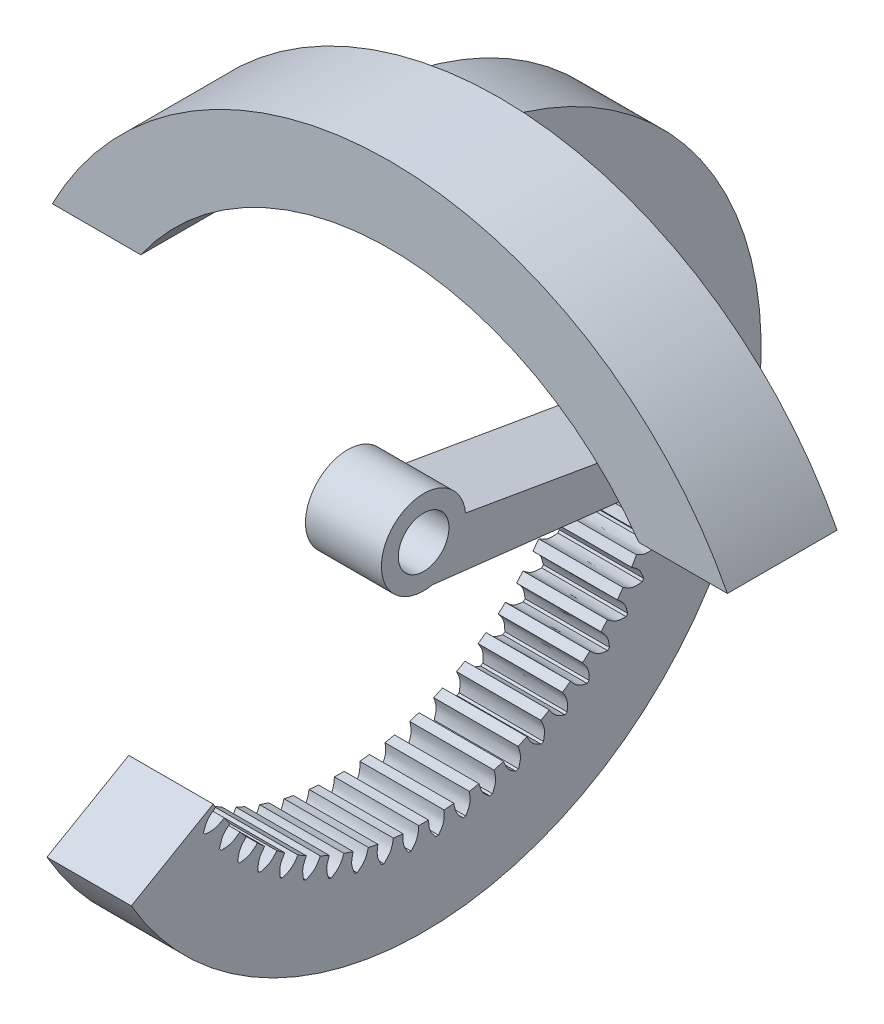
from build123d import *

# Parameters (mm, degrees)
KUGGLUCKA_DEPTH          = 15
CIRPATTERN_COUNT         = 60
SKETCH1_R                = 40
BOSS_EXTRUDE1_DEPTH      = 10
COMBINE3_START           = -12.5
COMBINE3_DEPTH           = 25
CUT_EXTRUDE1_DEPTH       = 10
BOSS_EXTRUDE2_DEPTH      = 4
BOSS_EXTRUDE2_DEPTH_BACK = 9
SKETCH4_R                = 5
BOSS_EXTRUDE3_DEPTH      = 9
BOSS_EXTRUDE4_DEPTH      = 9
SKETCH6_R                = 3
CUT_EXTRUDE2_DEPTH       = 9


# Read off the part's stored shape, not the designer's step: Combine3
with BuildPart() as part:
    # Ritning 1 → Kugghjulsämne (revolve)
    with BuildSketch(Plane.XY, mode=Mode.PRIVATE) as kugghjuls_mne_sk:
        Polygon((-12.5, -9.5), (12.5, -9.5), (12.5, 4.5), (2.5, 4.5), (2.5, 15.5), (-12.5, 15.5), align=None)
    revolve(kugghjuls_mne_sk.sketch.rotate(Axis((-12.5, -15.5, 0), (1, 0, 0)), 90), axis=Axis((-12.5, -15.5, 0), (1, 0, 0)))

    # Ritning 2 → Kugglucka (cut)
    with BuildSketch(Plane.ZY.offset(12.5)):
        with BuildLine():
            Line((1.468439282, 15.465201212), (0, 16.933640493))
            Line((0, 16.933640493), (-1.468439282, 15.465201212))
            add(Edge.make_bspline(
                [(-1.468439282, 15.465201212), (-1.201451518, 15.156321595), (-0.662309062, 14.532584713), (-0.604027899, 13.709668563), (-0.574608045, 13.294267235)],
                knots=[0, 0, 0, 0, 0.495208197, 1, 1, 1, 1], degree=3))
            ThreePointArc((-0.574608045, 13.294267235), (0, 13.3), (0.574608045, 13.294267235))
            add(Edge.make_bspline(
                [(1.468439282, 15.465201212), (1.201451518, 15.156321595), (0.662309062, 14.532584713), (0.604027899, 13.709668563), (0.574608045, 13.294267235)],
                knots=[0, 0, 0, 0, 0.495208197, 1, 1, 1, 1], degree=3))
        make_face()
    kugglucka = extrude(amount=-KUGGLUCKA_DEPTH, mode=Mode.SUBTRACT)

    # CirPattern: Kugglucka ×60 about axis
    cirpattern_axis = Axis((-12.5, -15.5, 0), (-1, 0, 0))
    for i in range(1, CIRPATTERN_COUNT):
        add(kugglucka.rotate(cirpattern_axis, i * 360 / CIRPATTERN_COUNT), mode=Mode.SUBTRACT)


with BuildPart() as body_2:
    # Sketch1 → Boss-Extrude1 (new body)
    with BuildSketch(Plane.ZY.offset(12.5)):
        with Locations((0, -15.5)):
            Circle(SKETCH1_R)
    extrude(amount=-BOSS_EXTRUDE1_DEPTH)


with BuildPart() as combine3_tool:
    # Combine3 outline → Combine3 (new body)
    with BuildSketch(Plane.YZ.offset(COMBINE3_START)):
        with BuildLine():
            ThreePointArc((13.294267235, -0.574608045), (13.3, 0), (13.294267235, 0.574608045))
            add(Edge.make_bspline(
                [(13.294267235, 0.574608045), (13.709668563, 0.604027899), (14.532584713, 0.662309062), (15.156321595, 1.201451518), (15.465201212, 1.468439282)],
                knots=[0, 0, 0, 0, 0.504791803, 1, 1, 1, 1], degree=3))
            ThreePointArc((15.465201212, 1.468439282), (15.457515577, 1.622414644), (15.449064301, 1.77634988))
            add(Edge.make_bspline(
                [(15.449064301, 1.77634988), (15.113968939, 2.009588344), (14.437293221, 2.480579064), (13.61279305, 2.452522797), (13.196592122, 2.438360223)],
                knots=[0, 0, 0, 0, 0.495208197, 1, 1, 1, 1], degree=3))
            ThreePointArc((13.196592122, 2.438360223), (13.142230587, 3.010419742), (13.07646633, 3.581280787))
            add(Edge.make_bspline(
                [(13.07646633, 3.581280787), (13.486516834, 3.653960738), (14.298832924, 3.797940792), (14.862797177, 4.399328027), (15.142076898, 4.697139915)],
                knots=[0, 0, 0, 0, 0.504791803, 1, 1, 1, 1], degree=3))
            ThreePointArc((15.142076898, 4.697139915), (15.118338558, 4.849468416), (15.093842965, 5.00167698))
            add(Edge.make_bspline(
                [(15.093842965, 5.00167698), (14.736203232, 5.198610737), (14.014002478, 5.596289447), (13.196951685, 5.482203139), (12.784511141, 5.424613306)],
                knots=[0, 0, 0, 0, 0.495208197, 1, 1, 1, 1], degree=3))
            ThreePointArc((12.784511141, 5.424613306), (12.670650901, 5.987856695), (12.54557568, 6.548716267))
            add(Edge.make_bspline(
                [(12.54557568, 6.548716267), (12.945782761, 6.663860019), (13.738598884, 6.891961488), (14.236611599, 7.549004577), (14.483231577, 7.874377701)],
                knots=[0, 0, 0, 0, 0.504791803, 1, 1, 1, 1], degree=3))
            ThreePointArc((14.483231577, 7.874377701), (14.443700615, 8.023390398), (14.403429084, 8.172204661))
            add(Edge.make_bspline(
                [(14.403429084, 8.172204661), (14.027163356, 8.330676062), (13.267350149, 8.650685712), (12.466700511, 8.451819317), (12.062539137, 8.35143319)],
                knots=[0, 0, 0, 0, 0.495208197, 1, 1, 1, 1], degree=3))
            ThreePointArc((12.062539137, 8.35143319), (11.890427669, 8.899689438), (11.707411835, 9.444402642))
            add(Edge.make_bspline(
                [(11.707411835, 9.444402642), (12.09339074, 9.600748655), (12.858020637, 9.910472411), (13.284625482, 10.615972654), (13.495883697, 10.965342156)],
                knots=[0, 0, 0, 0, 0.504791803, 1, 1, 1, 1], degree=3))
            ThreePointArc((13.495883697, 10.965342156), (13.440993221, 11.109406436), (13.385386976, 11.253195957))
            add(Edge.make_bspline(
                [(13.385386976, 11.253195957), (12.994617699, 11.371468757), (12.205516711, 11.610303254), (11.430040315, 11.328835593), (11.038586186, 11.186753025)],
                knots=[0, 0, 0, 0, 0.495208197, 1, 1, 1, 1], degree=3))
            ThreePointArc((11.038586186, 11.186753025), (10.81010918, 11.714015321), (10.571157891, 12.236614165))
            add(Edge.make_bspline(
                [(10.571157891, 12.236614165), (10.938679755, 12.43244948), (11.666745982, 12.820402125), (12.017268984, 13.566629912), (12.190850848, 13.936168029)],
                knots=[0, 0, 0, 0, 0.504791803, 1, 1, 1, 1], degree=3))
            ThreePointArc((12.190850848, 13.936168029), (12.12120225, 14.073705492), (12.050870523, 14.210894884))
            add(Edge.make_bspline(
                [(12.050870523, 14.210894884), (11.649879047, 14.287673261), (10.840135834, 14.442715884), (10.098328961, 14.081730776), (9.723870931, 13.899508453)],
                knots=[0, 0, 0, 0, 0.495208197, 1, 1, 1, 1], degree=3))
            ThreePointArc((9.723870931, 13.899508453), (9.441531629, 14.4), (9.149262886, 14.894758782))
            add(Edge.make_bspline(
                [(9.149262886, 14.894758782), (9.494301062, 15.127937786), (10.177826772, 15.58986883), (10.448427529, 16.368648334), (10.582431242, 16.754306328)],
                knots=[0, 0, 0, 0, 0.504791803, 1, 1, 1, 1], degree=3))
            ThreePointArc((10.582431242, 16.754306328), (10.498787606, 16.883810085), (10.414500968, 17.012896272))
            add(Edge.make_bspline(
                [(10.414500968, 17.012896272), (10.00768064, 17.047339027), (9.186166918, 17.116891096), (8.486156958, 16.68034357), (8.132797668, 16.459977958)],
                knots=[0, 0, 0, 0, 0.495208197, 1, 1, 1, 1], degree=3))
            ThreePointArc((8.132797668, 16.459977958), (7.799689438, 16.928215266), (7.457305399, 17.389713305))
            add(Edge.make_bspline(
                [(7.457305399, 17.389713305), (7.776079576, 17.657681241), (8.407575919, 18.18852967), (8.595289672, 18.99132842), (8.688247061, 19.388880941)],
                knots=[0, 0, 0, 0, 0.504791803, 1, 1, 1, 1], degree=3))
            ThreePointArc((8.688247061, 19.388880941), (8.591524805, 19.508932123), (8.494206717, 19.628500809))
            add(Edge.make_bspline(
                [(8.494206717, 19.628500809), (8.086014745, 19.620230579), (7.26173119, 19.603530067), (6.611187601, 19.096203029), (6.282798529, 18.840108499)],
                knots=[0, 0, 0, 0, 0.495208197, 1, 1, 1, 1], degree=3))
            ThreePointArc((6.282798529, 18.840108499), (5.902570974, 19.270961463), (5.513822869, 19.69414249))
            add(Edge.make_bspline(
                [(5.513822869, 19.69414249), (5.802840492, 19.993963444), (6.375388661, 20.587913172), (6.478158779, 21.405935537), (6.529051383, 21.811026917)],
                knots=[0, 0, 0, 0, 0.504791803, 1, 1, 1, 1], degree=3))
            ThreePointArc((6.529051383, 21.811026917), (6.420310217, 21.920310217), (6.311026917, 22.029051383))
            add(Edge.make_bspline(
                [(6.311026917, 22.029051383), (5.905935537, 21.978158779), (5.087913172, 21.875388661), (4.493963444, 21.302840492), (4.19414249, 21.013822869)],
                knots=[0, 0, 0, 0, 0.495208197, 1, 1, 1, 1], degree=3))
            ThreePointArc((4.19414249, 21.013822869), (3.770961463, 21.402570974), (3.340108499, 21.782798529))
            add(Edge.make_bspline(
                [(3.340108499, 21.782798529), (3.596203029, 22.111187601), (4.103530067, 22.76173119), (4.120230579, 23.586014745), (4.128500809, 23.994206717)],
                knots=[0, 0, 0, 0, 0.504791803, 1, 1, 1, 1], degree=3))
            ThreePointArc((4.128500809, 23.994206717), (4.008932123, 24.091524805), (3.888880941, 24.188247061))
            add(Edge.make_bspline(
                [(3.888880941, 24.188247061), (3.49132842, 24.095289672), (2.68852967, 23.907575919), (2.157681241, 23.276079576), (1.889713305, 22.957305399)],
                knots=[0, 0, 0, 0, 0.495208197, 1, 1, 1, 1], degree=3))
            ThreePointArc((1.889713305, 22.957305399), (1.428215266, 23.299689438), (0.959977958, 23.632797668))
            add(Edge.make_bspline(
                [(0.959977958, 23.632797668), (1.18034357, 23.986156958), (1.616891096, 24.686166918), (1.547339027, 25.50768064), (1.512896272, 25.914500968)],
                knots=[0, 0, 0, 0, 0.504791803, 1, 1, 1, 1], degree=3))
            ThreePointArc((1.512896272, 25.914500968), (1.383810085, 25.998787606), (1.254306328, 26.082431242))
            add(Edge.make_bspline(
                [(1.254306328, 26.082431242), (0.868648334, 25.948427529), (0.08986883, 25.677826772), (-0.372062214, 24.994301062), (-0.605241218, 24.649262886)],
                knots=[0, 0, 0, 0, 0.495208197, 1, 1, 1, 1], degree=3))
            ThreePointArc((-0.605241218, 24.649262886), (-1.1, 24.941531629), (-1.600491547, 25.223870931))
            add(Edge.make_bspline(
                [(-1.600491547, 25.223870931), (-1.418269224, 25.598328961), (-1.057284116, 26.340135834), (-1.212326739, 27.149879047), (-1.289105116, 27.550870523)],
                knots=[0, 0, 0, 0, 0.504791803, 1, 1, 1, 1], degree=3))
            ThreePointArc((-1.289105116, 27.550870523), (-1.426294508, 27.62120225), (-1.563831971, 27.690850848))
            add(Edge.make_bspline(
                [(-1.563831971, 27.690850848), (-1.933370088, 27.517268984), (-2.679597875, 27.166745982), (-3.06755052, 26.438679755), (-3.263385835, 26.071157891)],
                knots=[0, 0, 0, 0, 0.495208197, 1, 1, 1, 1], degree=3))
            ThreePointArc((-3.263385835, 26.071157891), (-3.785984679, 26.31010918), (-4.313246975, 26.538586186))
            add(Edge.make_bspline(
                [(-4.313246975, 26.538586186), (-4.171164407, 26.930040315), (-3.889696746, 27.705516711), (-4.128531243, 28.494617699), (-4.246804043, 28.885386976)],
                knots=[0, 0, 0, 0, 0.504791803, 1, 1, 1, 1], degree=3))
            ThreePointArc((-4.246804043, 28.885386976), (-4.390593564, 28.940993221), (-4.534657844, 28.995883697))
            add(Edge.make_bspline(
                [(-4.534657844, 28.995883697), (-4.884027346, 28.784625482), (-5.589527589, 28.358020637), (-5.899251345, 27.59339074), (-6.055597358, 27.207411835)],
                knots=[0, 0, 0, 0, 0.495208197, 1, 1, 1, 1], degree=3))
            ThreePointArc((-6.055597358, 27.207411835), (-6.600310562, 27.390427669), (-7.14856681, 27.562539137))
            add(Edge.make_bspline(
                [(-7.14856681, 27.562539137), (-7.048180683, 27.966700511), (-6.849314288, 28.767350149), (-7.169323938, 29.527163356), (-7.327795339, 29.903429084)],
                knots=[0, 0, 0, 0, 0.504791803, 1, 1, 1, 1], degree=3))
            ThreePointArc((-7.327795339, 29.903429084), (-7.476609602, 29.943700615), (-7.625622299, 29.983231577))
            add(Edge.make_bspline(
                [(-7.625622299, 29.983231577), (-7.950995423, 29.736611599), (-8.608038512, 29.238598884), (-8.836139981, 28.445782761), (-8.951283733, 28.04557568)],
                knots=[0, 0, 0, 0, 0.495208197, 1, 1, 1, 1], degree=3))
            ThreePointArc((-8.951283733, 28.04557568), (-9.512143305, 28.170650901), (-10.075386694, 28.284511141))
            add(Edge.make_bspline(
                [(-10.075386694, 28.284511141), (-10.017796861, 28.696951685), (-9.903710553, 29.514002478), (-10.301389263, 30.236203232), (-10.49832302, 30.593842965)],
                knots=[0, 0, 0, 0, 0.504791803, 1, 1, 1, 1], degree=3))
            ThreePointArc((-10.49832302, 30.593842965), (-10.650531584, 30.618338558), (-10.802860085, 30.642076898))
            add(Edge.make_bspline(
                [(-10.802860085, 30.642076898), (-11.100671973, 30.362797177), (-11.702059208, 29.798832924), (-11.846039262, 28.986516834), (-11.918719213, 28.57646633)],
                knots=[0, 0, 0, 0, 0.495208197, 1, 1, 1, 1], degree=3))
            ThreePointArc((-11.918719213, 28.57646633), (-12.489580258, 28.642230587), (-13.061639777, 28.696592122))
            add(Edge.make_bspline(
                [(-13.061639777, 28.696592122), (-13.047477203, 29.11279305), (-13.019420936, 29.937293221), (-13.490411656, 30.613968939), (-13.72365012, 30.949064301)],
                knots=[0, 0, 0, 0, 0.504791803, 1, 1, 1, 1], degree=3))
            ThreePointArc((-13.72365012, 30.949064301), (-13.877585356, 30.957515577), (-14.031560718, 30.965201212))
            add(Edge.make_bspline(
                [(-14.031560718, 30.965201212), (-14.298548482, 30.656321595), (-14.837690938, 30.032584713), (-14.895972101, 29.209668563), (-14.925391955, 28.794267235)],
                knots=[0, 0, 0, 0, 0.495208197, 1, 1, 1, 1], degree=3))
            ThreePointArc((-14.925391955, 28.794267235), (-15.5, 28.8), (-16.074608045, 28.794267235))
            add(Edge.make_bspline(
                [(-16.074608045, 28.794267235), (-16.104027899, 29.209668563), (-16.162309062, 30.032584713), (-16.701451518, 30.656321595), (-16.968439282, 30.965201212)],
                knots=[0, 0, 0, 0, 0.504791803, 1, 1, 1, 1], degree=3))
            ThreePointArc((-16.968439282, 30.965201212), (-17.122414644, 30.957515577), (-17.27634988, 30.949064301))
            add(Edge.make_bspline(
                [(-17.27634988, 30.949064301), (-17.509588344, 30.613968939), (-17.980579064, 29.937293221), (-17.952522797, 29.11279305), (-17.938360223, 28.696592122)],
                knots=[0, 0, 0, 0, 0.495208197, 1, 1, 1, 1], degree=3))
            ThreePointArc((-17.938360223, 28.696592122), (-18.510419742, 28.642230587), (-19.081280787, 28.57646633))
            add(Edge.make_bspline(
                [(-19.081280787, 28.57646633), (-19.153960738, 28.986516834), (-19.297940792, 29.798832924), (-19.899328027, 30.362797177), (-20.197139915, 30.642076898)],
                knots=[0, 0, 0, 0, 0.504791803, 1, 1, 1, 1], degree=3))
            ThreePointArc((-20.197139915, 30.642076898), (-20.349468416, 30.618338558), (-20.50167698, 30.593842965))
            add(Edge.make_bspline(
                [(-20.50167698, 30.593842965), (-20.698610737, 30.236203232), (-21.096289447, 29.514002478), (-20.982203139, 28.696951685), (-20.924613306, 28.284511141)],
                knots=[0, 0, 0, 0, 0.495208197, 1, 1, 1, 1], degree=3))
            ThreePointArc((-20.924613306, 28.284511141), (-21.487856695, 28.170650901), (-22.048716267, 28.04557568))
            add(Edge.make_bspline(
                [(-22.048716267, 28.04557568), (-22.163860019, 28.445782761), (-22.391961488, 29.238598884), (-23.049004577, 29.736611599), (-23.374377701, 29.983231577)],
                knots=[0, 0, 0, 0, 0.504791803, 1, 1, 1, 1], degree=3))
            ThreePointArc((-23.374377701, 29.983231577), (-23.523390398, 29.943700615), (-23.672204661, 29.903429084))
            add(Edge.make_bspline(
                [(-23.672204661, 29.903429084), (-23.830676062, 29.527163356), (-24.150685712, 28.767350149), (-23.951819317, 27.966700511), (-23.85143319, 27.562539137)],
                knots=[0, 0, 0, 0, 0.495208197, 1, 1, 1, 1], degree=3))
            ThreePointArc((-23.85143319, 27.562539137), (-24.399689438, 27.390427669), (-24.944402642, 27.207411835))
            add(Edge.make_bspline(
                [(-24.944402642, 27.207411835), (-25.100748655, 27.59339074), (-25.410472411, 28.358020637), (-26.115972654, 28.784625482), (-26.465342156, 28.995883697)],
                knots=[0, 0, 0, 0, 0.504791803, 1, 1, 1, 1], degree=3))
            ThreePointArc((-26.465342156, 28.995883697), (-26.609406436, 28.940993221), (-26.753195957, 28.885386976))
            add(Edge.make_bspline(
                [(-26.753195957, 28.885386976), (-26.871468757, 28.494617699), (-27.110303254, 27.705516711), (-26.828835593, 26.930040315), (-26.686753025, 26.538586186)],
                knots=[0, 0, 0, 0, 0.495208197, 1, 1, 1, 1], degree=3))
            ThreePointArc((-26.686753025, 26.538586186), (-27.214015321, 26.31010918), (-27.736614165, 26.071157891))
            add(Edge.make_bspline(
                [(-27.736614165, 26.071157891), (-27.93244948, 26.438679755), (-28.320402125, 27.166745982), (-29.066629912, 27.517268984), (-29.436168029, 27.690850848)],
                knots=[0, 0, 0, 0, 0.504791803, 1, 1, 1, 1], degree=3))
            ThreePointArc((-29.436168029, 27.690850848), (-29.573705492, 27.62120225), (-29.710894884, 27.550870523))
            add(Edge.make_bspline(
                [(-29.710894884, 27.550870523), (-29.787673261, 27.149879047), (-29.942715884, 26.340135834), (-29.581730776, 25.598328961), (-29.399508453, 25.223870931)],
                knots=[0, 0, 0, 0, 0.495208197, 1, 1, 1, 1], degree=3))
            ThreePointArc((-29.399508453, 25.223870931), (-29.9, 24.941531629), (-30.394758782, 24.649262886))
            add(Edge.make_bspline(
                [(-30.394758782, 24.649262886), (-30.627937786, 24.994301062), (-31.08986883, 25.677826772), (-31.868648334, 25.948427529), (-32.254306328, 26.082431242)],
                knots=[0, 0, 0, 0, 0.504791803, 1, 1, 1, 1], degree=3))
            ThreePointArc((-32.254306328, 26.082431242), (-32.383810085, 25.998787606), (-32.512896272, 25.914500968))
            add(Edge.make_bspline(
                [(-32.512896272, 25.914500968), (-32.547339027, 25.50768064), (-32.616891096, 24.686166918), (-32.18034357, 23.986156958), (-31.959977958, 23.632797668)],
                knots=[0, 0, 0, 0, 0.495208197, 1, 1, 1, 1], degree=3))
            ThreePointArc((-31.959977958, 23.632797668), (-32.428215266, 23.299689438), (-32.889713305, 22.957305399))
            add(Edge.make_bspline(
                [(-32.889713305, 22.957305399), (-33.157681241, 23.276079576), (-33.68852967, 23.907575919), (-34.49132842, 24.095289672), (-34.888880941, 24.188247061)],
                knots=[0, 0, 0, 0, 0.504791803, 1, 1, 1, 1], degree=3))
            ThreePointArc((-34.888880941, 24.188247061), (-35.008932123, 24.091524805), (-35.128500809, 23.994206717))
            add(Edge.make_bspline(
                [(-35.128500809, 23.994206717), (-35.120230579, 23.586014745), (-35.103530067, 22.76173119), (-34.596203029, 22.111187601), (-34.340108499, 21.782798529)],
                knots=[0, 0, 0, 0, 0.495208197, 1, 1, 1, 1], degree=3))
            ThreePointArc((-34.340108499, 21.782798529), (-34.770961463, 21.402570974), (-35.19414249, 21.013822869))
            add(Edge.make_bspline(
                [(-35.19414249, 21.013822869), (-35.493963444, 21.302840492), (-36.087913172, 21.875388661), (-36.905935537, 21.978158779), (-37.311026917, 22.029051383)],
                knots=[0, 0, 0, 0, 0.504791803, 1, 1, 1, 1], degree=3))
            ThreePointArc((-37.311026917, 22.029051383), (-37.420310217, 21.920310217), (-37.529051383, 21.811026917))
            add(Edge.make_bspline(
                [(-37.529051383, 21.811026917), (-37.478158779, 21.405935537), (-37.375388661, 20.587913172), (-36.802840492, 19.993963444), (-36.513822869, 19.69414249)],
                knots=[0, 0, 0, 0, 0.495208197, 1, 1, 1, 1], degree=3))
            ThreePointArc((-36.513822869, 19.69414249), (-36.902570974, 19.270961463), (-37.282798529, 18.840108499))
            add(Edge.make_bspline(
                [(-37.282798529, 18.840108499), (-37.611187601, 19.096203029), (-38.26173119, 19.603530067), (-39.086014745, 19.620230579), (-39.494206717, 19.628500809)],
                knots=[0, 0, 0, 0, 0.504791803, 1, 1, 1, 1], degree=3))
            ThreePointArc((-39.494206717, 19.628500809), (-39.591524805, 19.508932123), (-39.688247061, 19.388880941))
            add(Edge.make_bspline(
                [(-39.688247061, 19.388880941), (-39.595289672, 18.99132842), (-39.407575919, 18.18852967), (-38.776079576, 17.657681241), (-38.457305399, 17.389713305)],
                knots=[0, 0, 0, 0, 0.495208197, 1, 1, 1, 1], degree=3))
            ThreePointArc((-38.457305399, 17.389713305), (-38.799689438, 16.928215266), (-39.132797668, 16.459977958))
            add(Edge.make_bspline(
                [(-39.132797668, 16.459977958), (-39.486156958, 16.68034357), (-40.186166918, 17.116891096), (-41.00768064, 17.047339027), (-41.414500968, 17.012896272)],
                knots=[0, 0, 0, 0, 0.504791803, 1, 1, 1, 1], degree=3))
            ThreePointArc((-41.414500968, 17.012896272), (-41.498787606, 16.883810085), (-41.582431242, 16.754306328))
            add(Edge.make_bspline(
                [(-41.582431242, 16.754306328), (-41.448427529, 16.368648334), (-41.177826772, 15.58986883), (-40.494301062, 15.127937786), (-40.149262886, 14.894758782)],
                knots=[0, 0, 0, 0, 0.495208197, 1, 1, 1, 1], degree=3))
            ThreePointArc((-40.149262886, 14.894758782), (-40.441531629, 14.4), (-40.723870931, 13.899508453))
            add(Edge.make_bspline(
                [(-40.723870931, 13.899508453), (-41.098328961, 14.081730776), (-41.840135834, 14.442715884), (-42.649879047, 14.287673261), (-43.050870523, 14.210894884)],
                knots=[0, 0, 0, 0, 0.504791803, 1, 1, 1, 1], degree=3))
            ThreePointArc((-43.050870523, 14.210894884), (-43.12120225, 14.073705492), (-43.190850848, 13.936168029))
            add(Edge.make_bspline(
                [(-43.190850848, 13.936168029), (-43.017268984, 13.566629912), (-42.666745982, 12.820402125), (-41.938679755, 12.43244948), (-41.571157891, 12.236614165)],
                knots=[0, 0, 0, 0, 0.495208197, 1, 1, 1, 1], degree=3))
            ThreePointArc((-41.571157891, 12.236614165), (-41.81010918, 11.714015321), (-42.038586186, 11.186753025))
            add(Edge.make_bspline(
                [(-42.038586186, 11.186753025), (-42.430040315, 11.328835593), (-43.205516711, 11.610303254), (-43.994617699, 11.371468757), (-44.385386976, 11.253195957)],
                knots=[0, 0, 0, 0, 0.504791803, 1, 1, 1, 1], degree=3))
            ThreePointArc((-44.385386976, 11.253195957), (-44.440993221, 11.109406436), (-44.495883697, 10.965342156))
            add(Edge.make_bspline(
                [(-44.495883697, 10.965342156), (-44.284625482, 10.615972654), (-43.858020637, 9.910472411), (-43.09339074, 9.600748655), (-42.707411835, 9.444402642)],
                knots=[0, 0, 0, 0, 0.495208197, 1, 1, 1, 1], degree=3))
            ThreePointArc((-42.707411835, 9.444402642), (-42.890427669, 8.899689438), (-43.062539137, 8.35143319))
            add(Edge.make_bspline(
                [(-43.062539137, 8.35143319), (-43.466700511, 8.451819317), (-44.267350149, 8.650685712), (-45.027163356, 8.330676062), (-45.403429084, 8.172204661)],
                knots=[0, 0, 0, 0, 0.504791803, 1, 1, 1, 1], degree=3))
            ThreePointArc((-45.403429084, 8.172204661), (-45.443700615, 8.023390398), (-45.483231577, 7.874377701))
            add(Edge.make_bspline(
                [(-45.483231577, 7.874377701), (-45.236611599, 7.549004577), (-44.738598884, 6.891961488), (-43.945782761, 6.663860019), (-43.54557568, 6.548716267)],
                knots=[0, 0, 0, 0, 0.495208197, 1, 1, 1, 1], degree=3))
            ThreePointArc((-43.54557568, 6.548716267), (-43.670650901, 5.987856695), (-43.784511141, 5.424613306))
            add(Edge.make_bspline(
                [(-43.784511141, 5.424613306), (-44.196951685, 5.482203139), (-45.014002478, 5.596289447), (-45.736203232, 5.198610737), (-46.093842965, 5.00167698)],
                knots=[0, 0, 0, 0, 0.504791803, 1, 1, 1, 1], degree=3))
            ThreePointArc((-46.093842965, 5.00167698), (-46.118338558, 4.849468416), (-46.142076898, 4.697139915))
            add(Edge.make_bspline(
                [(-46.142076898, 4.697139915), (-45.862797177, 4.399328027), (-45.298832924, 3.797940792), (-44.486516834, 3.653960738), (-44.07646633, 3.581280787)],
                knots=[0, 0, 0, 0, 0.495208197, 1, 1, 1, 1], degree=3))
            ThreePointArc((-44.07646633, 3.581280787), (-44.142230587, 3.010419742), (-44.196592122, 2.438360223))
            add(Edge.make_bspline(
                [(-44.196592122, 2.438360223), (-44.61279305, 2.452522797), (-45.437293221, 2.480579064), (-46.113968939, 2.009588344), (-46.449064301, 1.77634988)],
                knots=[0, 0, 0, 0, 0.504791803, 1, 1, 1, 1], degree=3))
            ThreePointArc((-46.449064301, 1.77634988), (-46.457515577, 1.622414644), (-46.465201212, 1.468439282))
            add(Edge.make_bspline(
                [(-46.465201212, 1.468439282), (-46.156321595, 1.201451518), (-45.532584713, 0.662309062), (-44.709668563, 0.604027899), (-44.294267235, 0.574608045)],
                knots=[0, 0, 0, 0, 0.495208197, 1, 1, 1, 1], degree=3))
            ThreePointArc((-44.294267235, 0.574608045), (-44.3, 0), (-44.294267235, -0.574608045))
            add(Edge.make_bspline(
                [(-44.294267235, -0.574608045), (-44.709668563, -0.604027899), (-45.532584713, -0.662309062), (-46.156321595, -1.201451518), (-46.465201212, -1.468439282)],
                knots=[0, 0, 0, 0, 0.504791803, 1, 1, 1, 1], degree=3))
            ThreePointArc((-46.465201212, -1.468439282), (-46.457515577, -1.622414644), (-46.449064301, -1.77634988))
            add(Edge.make_bspline(
                [(-46.449064301, -1.77634988), (-46.113968939, -2.009588344), (-45.437293221, -2.480579064), (-44.61279305, -2.452522797), (-44.196592122, -2.438360223)],
                knots=[0, 0, 0, 0, 0.495208197, 1, 1, 1, 1], degree=3))
            ThreePointArc((-44.196592122, -2.438360223), (-44.142230587, -3.010419742), (-44.07646633, -3.581280787))
            add(Edge.make_bspline(
                [(-44.07646633, -3.581280787), (-44.486516834, -3.653960738), (-45.298832924, -3.797940792), (-45.862797177, -4.399328027), (-46.142076898, -4.697139915)],
                knots=[0, 0, 0, 0, 0.504791803, 1, 1, 1, 1], degree=3))
            ThreePointArc((-46.142076898, -4.697139915), (-46.118338558, -4.849468416), (-46.093842965, -5.00167698))
            add(Edge.make_bspline(
                [(-46.093842965, -5.00167698), (-45.736203232, -5.198610737), (-45.014002478, -5.596289447), (-44.196951685, -5.482203139), (-43.784511141, -5.424613306)],
                knots=[0, 0, 0, 0, 0.495208197, 1, 1, 1, 1], degree=3))
            ThreePointArc((-43.784511141, -5.424613306), (-43.670650901, -5.987856695), (-43.54557568, -6.548716267))
            add(Edge.make_bspline(
                [(-43.54557568, -6.548716267), (-43.945782761, -6.663860019), (-44.738598884, -6.891961488), (-45.236611599, -7.549004577), (-45.483231577, -7.874377701)],
                knots=[0, 0, 0, 0, 0.504791803, 1, 1, 1, 1], degree=3))
            ThreePointArc((-45.483231577, -7.874377701), (-45.443700615, -8.023390398), (-45.403429084, -8.172204661))
            add(Edge.make_bspline(
                [(-45.403429084, -8.172204661), (-45.027163356, -8.330676062), (-44.267350149, -8.650685712), (-43.466700511, -8.451819317), (-43.062539137, -8.35143319)],
                knots=[0, 0, 0, 0, 0.495208197, 1, 1, 1, 1], degree=3))
            ThreePointArc((-43.062539137, -8.35143319), (-42.890427669, -8.899689438), (-42.707411835, -9.444402642))
            add(Edge.make_bspline(
                [(-42.707411835, -9.444402642), (-43.09339074, -9.600748655), (-43.858020637, -9.910472411), (-44.284625482, -10.615972654), (-44.495883697, -10.965342156)],
                knots=[0, 0, 0, 0, 0.504791803, 1, 1, 1, 1], degree=3))
            ThreePointArc((-44.495883697, -10.965342156), (-44.440993221, -11.109406436), (-44.385386976, -11.253195957))
            add(Edge.make_bspline(
                [(-44.385386976, -11.253195957), (-43.994617699, -11.371468757), (-43.205516711, -11.610303254), (-42.430040315, -11.328835593), (-42.038586186, -11.186753025)],
                knots=[0, 0, 0, 0, 0.495208197, 1, 1, 1, 1], degree=3))
            ThreePointArc((-42.038586186, -11.186753025), (-41.81010918, -11.714015321), (-41.571157891, -12.236614165))
            add(Edge.make_bspline(
                [(-41.571157891, -12.236614165), (-41.938679755, -12.43244948), (-42.666745982, -12.820402125), (-43.017268984, -13.566629912), (-43.190850848, -13.936168029)],
                knots=[0, 0, 0, 0, 0.504791803, 1, 1, 1, 1], degree=3))
            ThreePointArc((-43.190850848, -13.936168029), (-43.12120225, -14.073705492), (-43.050870523, -14.210894884))
            add(Edge.make_bspline(
                [(-43.050870523, -14.210894884), (-42.649879047, -14.287673261), (-41.840135834, -14.442715884), (-41.098328961, -14.081730776), (-40.723870931, -13.899508453)],
                knots=[0, 0, 0, 0, 0.495208197, 1, 1, 1, 1], degree=3))
            ThreePointArc((-40.723870931, -13.899508453), (-40.441531629, -14.4), (-40.149262886, -14.894758782))
            add(Edge.make_bspline(
                [(-40.149262886, -14.894758782), (-40.494301062, -15.127937786), (-41.177826772, -15.58986883), (-41.448427529, -16.368648334), (-41.582431242, -16.754306328)],
                knots=[0, 0, 0, 0, 0.504791803, 1, 1, 1, 1], degree=3))
            ThreePointArc((-41.582431242, -16.754306328), (-41.498787606, -16.883810085), (-41.414500968, -17.012896272))
            add(Edge.make_bspline(
                [(-41.414500968, -17.012896272), (-41.00768064, -17.047339027), (-40.186166918, -17.116891096), (-39.486156958, -16.68034357), (-39.132797668, -16.459977958)],
                knots=[0, 0, 0, 0, 0.495208197, 1, 1, 1, 1], degree=3))
            ThreePointArc((-39.132797668, -16.459977958), (-38.799689438, -16.928215266), (-38.457305399, -17.389713305))
            add(Edge.make_bspline(
                [(-38.457305399, -17.389713305), (-38.776079576, -17.657681241), (-39.407575919, -18.18852967), (-39.595289672, -18.99132842), (-39.688247061, -19.388880941)],
                knots=[0, 0, 0, 0, 0.504791803, 1, 1, 1, 1], degree=3))
            ThreePointArc((-39.688247061, -19.388880941), (-39.591524805, -19.508932123), (-39.494206717, -19.628500809))
            add(Edge.make_bspline(
                [(-39.494206717, -19.628500809), (-39.086014745, -19.620230579), (-38.26173119, -19.603530067), (-37.611187601, -19.096203029), (-37.282798529, -18.840108499)],
                knots=[0, 0, 0, 0, 0.495208197, 1, 1, 1, 1], degree=3))
            ThreePointArc((-37.282798529, -18.840108499), (-36.902570974, -19.270961463), (-36.513822869, -19.69414249))
            add(Edge.make_bspline(
                [(-36.513822869, -19.69414249), (-36.802840492, -19.993963444), (-37.375388661, -20.587913172), (-37.478158779, -21.405935537), (-37.529051383, -21.811026917)],
                knots=[0, 0, 0, 0, 0.504791803, 1, 1, 1, 1], degree=3))
            ThreePointArc((-37.529051383, -21.811026917), (-37.420310217, -21.920310217), (-37.311026917, -22.029051383))
            add(Edge.make_bspline(
                [(-37.311026917, -22.029051383), (-36.905935537, -21.978158779), (-36.087913172, -21.875388661), (-35.493963444, -21.302840492), (-35.19414249, -21.013822869)],
                knots=[0, 0, 0, 0, 0.495208197, 1, 1, 1, 1], degree=3))
            ThreePointArc((-35.19414249, -21.013822869), (-34.770961463, -21.402570974), (-34.340108499, -21.782798529))
            add(Edge.make_bspline(
                [(-34.340108499, -21.782798529), (-34.596203029, -22.111187601), (-35.103530067, -22.76173119), (-35.120230579, -23.586014745), (-35.128500809, -23.994206717)],
                knots=[0, 0, 0, 0, 0.504791803, 1, 1, 1, 1], degree=3))
            ThreePointArc((-35.128500809, -23.994206717), (-35.008932123, -24.091524805), (-34.888880941, -24.188247061))
            add(Edge.make_bspline(
                [(-34.888880941, -24.188247061), (-34.49132842, -24.095289672), (-33.68852967, -23.907575919), (-33.157681241, -23.276079576), (-32.889713305, -22.957305399)],
                knots=[0, 0, 0, 0, 0.495208197, 1, 1, 1, 1], degree=3))
            ThreePointArc((-32.889713305, -22.957305399), (-32.428215266, -23.299689438), (-31.959977958, -23.632797668))
            add(Edge.make_bspline(
                [(-31.959977958, -23.632797668), (-32.18034357, -23.986156958), (-32.616891096, -24.686166918), (-32.547339027, -25.50768064), (-32.512896272, -25.914500968)],
                knots=[0, 0, 0, 0, 0.504791803, 1, 1, 1, 1], degree=3))
            ThreePointArc((-32.512896272, -25.914500968), (-32.383810085, -25.998787606), (-32.254306328, -26.082431242))
            add(Edge.make_bspline(
                [(-32.254306328, -26.082431242), (-31.868648334, -25.948427529), (-31.08986883, -25.677826772), (-30.627937786, -24.994301062), (-30.394758782, -24.649262886)],
                knots=[0, 0, 0, 0, 0.495208197, 1, 1, 1, 1], degree=3))
            ThreePointArc((-30.394758782, -24.649262886), (-29.9, -24.941531629), (-29.399508453, -25.223870931))
            add(Edge.make_bspline(
                [(-29.399508453, -25.223870931), (-29.581730776, -25.598328961), (-29.942715884, -26.340135834), (-29.787673261, -27.149879047), (-29.710894884, -27.550870523)],
                knots=[0, 0, 0, 0, 0.504791803, 1, 1, 1, 1], degree=3))
            ThreePointArc((-29.710894884, -27.550870523), (-29.573705492, -27.62120225), (-29.436168029, -27.690850848))
            add(Edge.make_bspline(
                [(-29.436168029, -27.690850848), (-29.066629912, -27.517268984), (-28.320402125, -27.166745982), (-27.93244948, -26.438679755), (-27.736614165, -26.071157891)],
                knots=[0, 0, 0, 0, 0.495208197, 1, 1, 1, 1], degree=3))
            ThreePointArc((-27.736614165, -26.071157891), (-27.214015321, -26.31010918), (-26.686753025, -26.538586186))
            add(Edge.make_bspline(
                [(-26.686753025, -26.538586186), (-26.828835593, -26.930040315), (-27.110303254, -27.705516711), (-26.871468757, -28.494617699), (-26.753195957, -28.885386976)],
                knots=[0, 0, 0, 0, 0.504791803, 1, 1, 1, 1], degree=3))
            ThreePointArc((-26.753195957, -28.885386976), (-26.609406436, -28.940993221), (-26.465342156, -28.995883697))
            add(Edge.make_bspline(
                [(-26.465342156, -28.995883697), (-26.115972654, -28.784625482), (-25.410472411, -28.358020637), (-25.100748655, -27.59339074), (-24.944402642, -27.207411835)],
                knots=[0, 0, 0, 0, 0.495208197, 1, 1, 1, 1], degree=3))
            ThreePointArc((-24.944402642, -27.207411835), (-24.399689438, -27.390427669), (-23.85143319, -27.562539137))
            add(Edge.make_bspline(
                [(-23.85143319, -27.562539137), (-23.951819317, -27.966700511), (-24.150685712, -28.767350149), (-23.830676062, -29.527163356), (-23.672204661, -29.903429084)],
                knots=[0, 0, 0, 0, 0.504791803, 1, 1, 1, 1], degree=3))
            ThreePointArc((-23.672204661, -29.903429084), (-23.523390398, -29.943700615), (-23.374377701, -29.983231577))
            add(Edge.make_bspline(
                [(-23.374377701, -29.983231577), (-23.049004577, -29.736611599), (-22.391961488, -29.238598884), (-22.163860019, -28.445782761), (-22.048716267, -28.04557568)],
                knots=[0, 0, 0, 0, 0.495208197, 1, 1, 1, 1], degree=3))
            ThreePointArc((-22.048716267, -28.04557568), (-21.487856695, -28.170650901), (-20.924613306, -28.284511141))
            add(Edge.make_bspline(
                [(-20.924613306, -28.284511141), (-20.982203139, -28.696951685), (-21.096289447, -29.514002478), (-20.698610737, -30.236203232), (-20.50167698, -30.593842965)],
                knots=[0, 0, 0, 0, 0.504791803, 1, 1, 1, 1], degree=3))
            ThreePointArc((-20.50167698, -30.593842965), (-20.349468416, -30.618338558), (-20.197139915, -30.642076898))
            add(Edge.make_bspline(
                [(-20.197139915, -30.642076898), (-19.899328027, -30.362797177), (-19.297940792, -29.798832924), (-19.153960738, -28.986516834), (-19.081280787, -28.57646633)],
                knots=[0, 0, 0, 0, 0.495208197, 1, 1, 1, 1], degree=3))
            ThreePointArc((-19.081280787, -28.57646633), (-18.510419742, -28.642230587), (-17.938360223, -28.696592122))
            add(Edge.make_bspline(
                [(-17.938360223, -28.696592122), (-17.952522797, -29.11279305), (-17.980579064, -29.937293221), (-17.509588344, -30.613968939), (-17.27634988, -30.949064301)],
                knots=[0, 0, 0, 0, 0.504791803, 1, 1, 1, 1], degree=3))
            ThreePointArc((-17.27634988, -30.949064301), (-17.122414644, -30.957515577), (-16.968439282, -30.965201212))
            add(Edge.make_bspline(
                [(-16.968439282, -30.965201212), (-16.701451518, -30.656321595), (-16.162309062, -30.032584713), (-16.104027899, -29.209668563), (-16.074608045, -28.794267235)],
                knots=[0, 0, 0, 0, 0.495208197, 1, 1, 1, 1], degree=3))
            ThreePointArc((-16.074608045, -28.794267235), (-15.5, -28.8), (-14.925391955, -28.794267235))
            add(Edge.make_bspline(
                [(-14.925391955, -28.794267235), (-14.895972101, -29.209668563), (-14.837690938, -30.032584713), (-14.298548482, -30.656321595), (-14.031560718, -30.965201212)],
                knots=[0, 0, 0, 0, 0.504791803, 1, 1, 1, 1], degree=3))
            ThreePointArc((-14.031560718, -30.965201212), (-13.877585356, -30.957515577), (-13.72365012, -30.949064301))
            add(Edge.make_bspline(
                [(-13.72365012, -30.949064301), (-13.490411656, -30.613968939), (-13.019420936, -29.937293221), (-13.047477203, -29.11279305), (-13.061639777, -28.696592122)],
                knots=[0, 0, 0, 0, 0.495208197, 1, 1, 1, 1], degree=3))
            ThreePointArc((-13.061639777, -28.696592122), (-12.489580258, -28.642230587), (-11.918719213, -28.57646633))
            add(Edge.make_bspline(
                [(-11.918719213, -28.57646633), (-11.846039262, -28.986516834), (-11.702059208, -29.798832924), (-11.100671973, -30.362797177), (-10.802860085, -30.642076898)],
                knots=[0, 0, 0, 0, 0.504791803, 1, 1, 1, 1], degree=3))
            ThreePointArc((-10.802860085, -30.642076898), (-10.650531584, -30.618338558), (-10.49832302, -30.593842965))
            add(Edge.make_bspline(
                [(-10.49832302, -30.593842965), (-10.301389263, -30.236203232), (-9.903710553, -29.514002478), (-10.017796861, -28.696951685), (-10.075386694, -28.284511141)],
                knots=[0, 0, 0, 0, 0.495208197, 1, 1, 1, 1], degree=3))
            ThreePointArc((-10.075386694, -28.284511141), (-9.512143305, -28.170650901), (-8.951283733, -28.04557568))
            add(Edge.make_bspline(
                [(-8.951283733, -28.04557568), (-8.836139981, -28.445782761), (-8.608038512, -29.238598884), (-7.950995423, -29.736611599), (-7.625622299, -29.983231577)],
                knots=[0, 0, 0, 0, 0.504791803, 1, 1, 1, 1], degree=3))
            ThreePointArc((-7.625622299, -29.983231577), (-7.476609602, -29.943700615), (-7.327795339, -29.903429084))
            add(Edge.make_bspline(
                [(-7.327795339, -29.903429084), (-7.169323938, -29.527163356), (-6.849314288, -28.767350149), (-7.048180683, -27.966700511), (-7.14856681, -27.562539137)],
                knots=[0, 0, 0, 0, 0.495208197, 1, 1, 1, 1], degree=3))
            ThreePointArc((-7.14856681, -27.562539137), (-6.600310562, -27.390427669), (-6.055597358, -27.207411835))
            add(Edge.make_bspline(
                [(-6.055597358, -27.207411835), (-5.899251345, -27.59339074), (-5.589527589, -28.358020637), (-4.884027346, -28.784625482), (-4.534657844, -28.995883697)],
                knots=[0, 0, 0, 0, 0.504791803, 1, 1, 1, 1], degree=3))
            ThreePointArc((-4.534657844, -28.995883697), (-4.390593564, -28.940993221), (-4.246804043, -28.885386976))
            add(Edge.make_bspline(
                [(-4.246804043, -28.885386976), (-4.128531243, -28.494617699), (-3.889696746, -27.705516711), (-4.171164407, -26.930040315), (-4.313246975, -26.538586186)],
                knots=[0, 0, 0, 0, 0.495208197, 1, 1, 1, 1], degree=3))
            ThreePointArc((-4.313246975, -26.538586186), (-3.785984679, -26.31010918), (-3.263385835, -26.071157891))
            add(Edge.make_bspline(
                [(-3.263385835, -26.071157891), (-3.06755052, -26.438679755), (-2.679597875, -27.166745982), (-1.933370088, -27.517268984), (-1.563831971, -27.690850848)],
                knots=[0, 0, 0, 0, 0.504791803, 1, 1, 1, 1], degree=3))
            ThreePointArc((-1.563831971, -27.690850848), (-1.426294508, -27.62120225), (-1.289105116, -27.550870523))
            add(Edge.make_bspline(
                [(-1.289105116, -27.550870523), (-1.212326739, -27.149879047), (-1.057284116, -26.340135834), (-1.418269224, -25.598328961), (-1.600491547, -25.223870931)],
                knots=[0, 0, 0, 0, 0.495208197, 1, 1, 1, 1], degree=3))
            ThreePointArc((-1.600491547, -25.223870931), (-1.1, -24.941531629), (-0.605241218, -24.649262886))
            add(Edge.make_bspline(
                [(-0.605241218, -24.649262886), (-0.372062214, -24.994301062), (0.08986883, -25.677826772), (0.868648334, -25.948427529), (1.254306328, -26.082431242)],
                knots=[0, 0, 0, 0, 0.504791803, 1, 1, 1, 1], degree=3))
            ThreePointArc((1.254306328, -26.082431242), (1.383810085, -25.998787606), (1.512896272, -25.914500968))
            add(Edge.make_bspline(
                [(1.512896272, -25.914500968), (1.547339027, -25.50768064), (1.616891096, -24.686166918), (1.18034357, -23.986156958), (0.959977958, -23.632797668)],
                knots=[0, 0, 0, 0, 0.495208197, 1, 1, 1, 1], degree=3))
            ThreePointArc((0.959977958, -23.632797668), (1.428215266, -23.299689438), (1.889713305, -22.957305399))
            add(Edge.make_bspline(
                [(1.889713305, -22.957305399), (2.157681241, -23.276079576), (2.68852967, -23.907575919), (3.49132842, -24.095289672), (3.888880941, -24.188247061)],
                knots=[0, 0, 0, 0, 0.504791803, 1, 1, 1, 1], degree=3))
            ThreePointArc((3.888880941, -24.188247061), (4.008932123, -24.091524805), (4.128500809, -23.994206717))
            add(Edge.make_bspline(
                [(4.128500809, -23.994206717), (4.120230579, -23.586014745), (4.103530067, -22.76173119), (3.596203029, -22.111187601), (3.340108499, -21.782798529)],
                knots=[0, 0, 0, 0, 0.495208197, 1, 1, 1, 1], degree=3))
            ThreePointArc((3.340108499, -21.782798529), (3.770961463, -21.402570974), (4.19414249, -21.013822869))
            add(Edge.make_bspline(
                [(4.19414249, -21.013822869), (4.493963444, -21.302840492), (5.087913172, -21.875388661), (5.905935537, -21.978158779), (6.311026917, -22.029051383)],
                knots=[0, 0, 0, 0, 0.504791803, 1, 1, 1, 1], degree=3))
            ThreePointArc((6.311026917, -22.029051383), (6.420310217, -21.920310217), (6.529051383, -21.811026917))
            add(Edge.make_bspline(
                [(6.529051383, -21.811026917), (6.478158779, -21.405935537), (6.375388661, -20.587913172), (5.802840492, -19.993963444), (5.513822869, -19.69414249)],
                knots=[0, 0, 0, 0, 0.495208197, 1, 1, 1, 1], degree=3))
            ThreePointArc((5.513822869, -19.69414249), (5.902570974, -19.270961463), (6.282798529, -18.840108499))
            add(Edge.make_bspline(
                [(6.282798529, -18.840108499), (6.611187601, -19.096203029), (7.26173119, -19.603530067), (8.086014745, -19.620230579), (8.494206717, -19.628500809)],
                knots=[0, 0, 0, 0, 0.504791803, 1, 1, 1, 1], degree=3))
            ThreePointArc((8.494206717, -19.628500809), (8.591524805, -19.508932123), (8.688247061, -19.388880941))
            add(Edge.make_bspline(
                [(8.688247061, -19.388880941), (8.595289672, -18.99132842), (8.407575919, -18.18852967), (7.776079576, -17.657681241), (7.457305399, -17.389713305)],
                knots=[0, 0, 0, 0, 0.495208197, 1, 1, 1, 1], degree=3))
            ThreePointArc((7.457305399, -17.389713305), (7.799689438, -16.928215266), (8.132797668, -16.459977958))
            add(Edge.make_bspline(
                [(8.132797668, -16.459977958), (8.486156958, -16.68034357), (9.186166918, -17.116891096), (10.00768064, -17.047339027), (10.414500968, -17.012896272)],
                knots=[0, 0, 0, 0, 0.504791803, 1, 1, 1, 1], degree=3))
            ThreePointArc((10.414500968, -17.012896272), (10.498787606, -16.883810085), (10.582431242, -16.754306328))
            add(Edge.make_bspline(
                [(10.582431242, -16.754306328), (10.448427529, -16.368648334), (10.177826772, -15.58986883), (9.494301062, -15.127937786), (9.149262886, -14.894758782)],
                knots=[0, 0, 0, 0, 0.495208197, 1, 1, 1, 1], degree=3))
            ThreePointArc((9.149262886, -14.894758782), (9.441531629, -14.4), (9.723870931, -13.899508453))
            add(Edge.make_bspline(
                [(9.723870931, -13.899508453), (10.098328961, -14.081730776), (10.840135834, -14.442715884), (11.649879047, -14.287673261), (12.050870523, -14.210894884)],
                knots=[0, 0, 0, 0, 0.504791803, 1, 1, 1, 1], degree=3))
            ThreePointArc((12.050870523, -14.210894884), (12.12120225, -14.073705492), (12.190850848, -13.936168029))
            add(Edge.make_bspline(
                [(12.190850848, -13.936168029), (12.017268984, -13.566629912), (11.666745982, -12.820402125), (10.938679755, -12.43244948), (10.571157891, -12.236614165)],
                knots=[0, 0, 0, 0, 0.495208197, 1, 1, 1, 1], degree=3))
            ThreePointArc((10.571157891, -12.236614165), (10.81010918, -11.714015321), (11.038586186, -11.186753025))
            add(Edge.make_bspline(
                [(11.038586186, -11.186753025), (11.430040315, -11.328835593), (12.205516711, -11.610303254), (12.994617699, -11.371468757), (13.385386976, -11.253195957)],
                knots=[0, 0, 0, 0, 0.504791803, 1, 1, 1, 1], degree=3))
            ThreePointArc((13.385386976, -11.253195957), (13.440993221, -11.109406436), (13.495883697, -10.965342156))
            add(Edge.make_bspline(
                [(13.495883697, -10.965342156), (13.284625482, -10.615972654), (12.858020637, -9.910472411), (12.09339074, -9.600748655), (11.707411835, -9.444402642)],
                knots=[0, 0, 0, 0, 0.495208197, 1, 1, 1, 1], degree=3))
            ThreePointArc((11.707411835, -9.444402642), (11.890427669, -8.899689438), (12.062539137, -8.35143319))
            add(Edge.make_bspline(
                [(12.062539137, -8.35143319), (12.466700511, -8.451819317), (13.267350149, -8.650685712), (14.027163356, -8.330676062), (14.403429084, -8.172204661)],
                knots=[0, 0, 0, 0, 0.504791803, 1, 1, 1, 1], degree=3))
            ThreePointArc((14.403429084, -8.172204661), (14.443700615, -8.023390398), (14.483231577, -7.874377701))
            add(Edge.make_bspline(
                [(14.483231577, -7.874377701), (14.236611599, -7.549004577), (13.738598884, -6.891961488), (12.945782761, -6.663860019), (12.54557568, -6.548716267)],
                knots=[0, 0, 0, 0, 0.495208197, 1, 1, 1, 1], degree=3))
            ThreePointArc((12.54557568, -6.548716267), (12.670650901, -5.987856695), (12.784511141, -5.424613306))
            add(Edge.make_bspline(
                [(12.784511141, -5.424613306), (13.196951685, -5.482203139), (14.014002478, -5.596289447), (14.736203232, -5.198610737), (15.093842965, -5.00167698)],
                knots=[0, 0, 0, 0, 0.504791803, 1, 1, 1, 1], degree=3))
            ThreePointArc((15.093842965, -5.00167698), (15.118338558, -4.849468416), (15.142076898, -4.697139915))
            add(Edge.make_bspline(
                [(15.142076898, -4.697139915), (14.862797177, -4.399328027), (14.298832924, -3.797940792), (13.486516834, -3.653960738), (13.07646633, -3.581280787)],
                knots=[0, 0, 0, 0, 0.495208197, 1, 1, 1, 1], degree=3))
            ThreePointArc((13.07646633, -3.581280787), (13.142230587, -3.010419742), (13.196592122, -2.438360223))
            add(Edge.make_bspline(
                [(13.196592122, -2.438360223), (13.61279305, -2.452522797), (14.437293221, -2.480579064), (15.113968939, -2.009588344), (15.449064301, -1.77634988)],
                knots=[0, 0, 0, 0, 0.504791803, 1, 1, 1, 1], degree=3))
            ThreePointArc((15.449064301, -1.77634988), (15.457515577, -1.622414644), (15.465201212, -1.468439282))
            add(Edge.make_bspline(
                [(15.465201212, -1.468439282), (15.156321595, -1.201451518), (14.532584713, -0.662309062), (13.709668563, -0.604027899), (13.294267235, -0.574608045)],
                knots=[0, 0, 0, 0, 0.495208197, 1, 1, 1, 1], degree=3))
        make_face()
    extrude(amount=COMBINE3_DEPTH)


with BuildPart() as part_1:
    add(part.part)

    # Combine3: cut by combine3_tool
    add(combine3_tool.part, mode=Mode.SUBTRACT)


with BuildPart() as body_2_1:
    add(body_2.part)

    # Combine3: cut by combine3_tool
    add(combine3_tool.part, mode=Mode.SUBTRACT)

    # Sketch2 → Cut-Extrude1 (cut)
    with BuildSketch(Plane(origin=(-2.5, 0, 0), x_dir=(0, 0, -1), z_dir=(1, 0, 0))):
        Polygon((0, 28.23683177), (0, -15.5), (-56.004097121, -47.833980548), (-67.354720926, -47.833980548), (-70.058452345, 28.23683177), align=None)
    extrude(amount=-CUT_EXTRUDE1_DEPTH, mode=Mode.SUBTRACT)

    # Sketch3 → Boss-Extrude2 (add, two sides: drawn at the far end of the back side and taken through both)
    with BuildSketch(Plane.XY.offset(-BOSS_EXTRUDE2_DEPTH_BACK)):
        with BuildLine():
            Line((-42.5, 1.240706191), (-32.012709127, 1.240706191))
            ThreePointArc((-32.012709127, 1.240706191), (-2.5, 16.625178063), (27.012709127, 1.240706191))
            Line((27.012709127, 1.240706191), (37.5, 1.240706191))
            ThreePointArc((37.5, 1.240706191), (-2.5, 25.625178063), (-42.5, 1.240706191))
        make_face()
    extrude(amount=BOSS_EXTRUDE2_DEPTH + BOSS_EXTRUDE2_DEPTH_BACK)



with BuildPart() as body_2_2:
    # Sketch4 → Boss-Extrude3 (new body)
    with BuildSketch(Plane(origin=(-2.5, 0, 0), x_dir=(0, 0, -1), z_dir=(1, 0, 0))):
        with Locations((0, -15.5)):
            Circle(SKETCH4_R)
    extrude(amount=-BOSS_EXTRUDE3_DEPTH)


with BuildPart() as body_2_3:
    add(body_2_1.part)

    add(body_2_2.part)  # Boss-Extrude4 merges body 2 2
    # Sketch5 → Boss-Extrude4 (add)
    with BuildSketch(Plane(origin=(-2.5, 0, 0), x_dir=(0, 0, -1), z_dir=(1, 0, 0))):
        Polygon((2.063492225, -14.489411188), (33.199477003, -19.865408559), (32.485226158, -24.002111367), (1.044749095, -20.389631819), align=None)
    extrude(amount=-BOSS_EXTRUDE4_DEPTH)

    # Sketch6 → Cut-Extrude2 (cut)
    with BuildSketch(Plane(origin=(-2.5, 0, 0), x_dir=(0, 0, -1), z_dir=(1, 0, 0))):
        with Locations((0, -15.5)):
            Circle(SKETCH6_R)
    extrude(amount=-CUT_EXTRUDE2_DEPTH, mode=Mode.SUBTRACT)


solid = body_2_3.part
